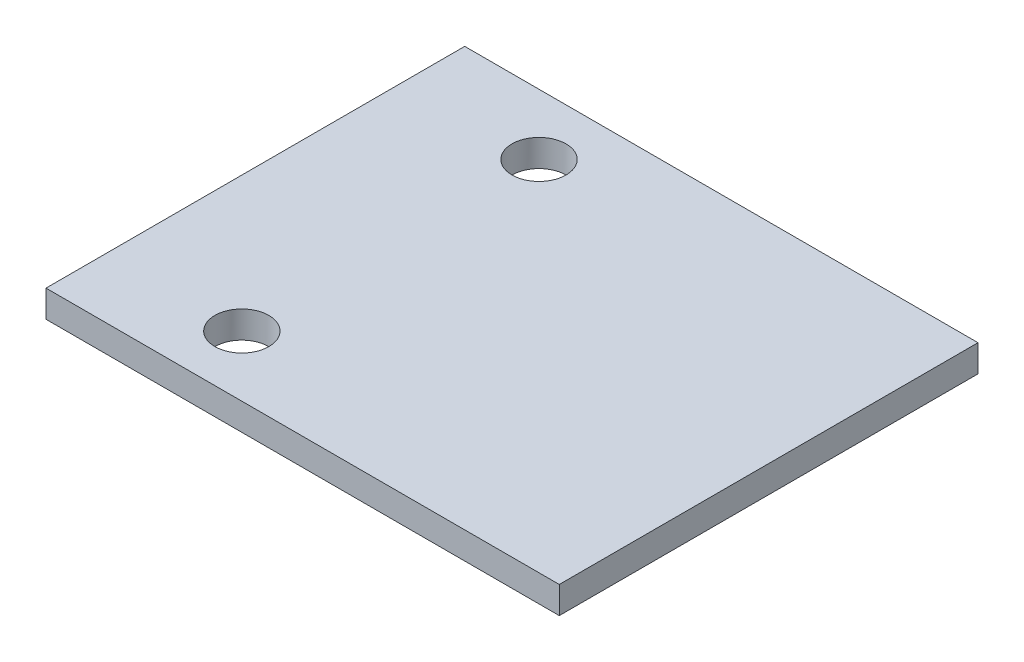
from build123d import *

# Parameters (mm, degrees)
SKETCH1_W                 = 19
SKETCH1_H                 = 15.5
BOSS_EXTRUDE1_DEPTH       = 1
F_1_0MM_DOWEL_HOLE1_D     = 2
F_1_0MM_DOWEL_HOLE1_DEPTH = 25
F_1_0MM_DOWEL_HOLE1_TIP   = 0.600860619


with BuildPart() as part:
    # Sketch1 → Boss-Extrude1 (new body)
    with BuildSketch(Plane(origin=(0, 0, 0), x_dir=(1, 0, 0), z_dir=(0, 1, 0))):
        with Locations((-2.301324503, -0.240066225)):
            Rectangle(SKETCH1_W, SKETCH1_H)
    extrude(amount=BOSS_EXTRUDE1_DEPTH)

    # Ø1.0mm Dowel Hole1
    with Locations(Plane(origin=(0, 1, 0), x_dir=(1, 0, 0), z_dir=(0, 1, 0))):
        with Locations((-6.801324503, 5.259933775), (-6.801324503, -5.740066225)):
            Hole(F_1_0MM_DOWEL_HOLE1_D / 2, depth=F_1_0MM_DOWEL_HOLE1_DEPTH)
            with Locations((0, 0, -(F_1_0MM_DOWEL_HOLE1_DEPTH + F_1_0MM_DOWEL_HOLE1_TIP / 2))):  # 118° drill point
                Cone(0, F_1_0MM_DOWEL_HOLE1_D / 2, F_1_0MM_DOWEL_HOLE1_TIP, mode=Mode.SUBTRACT)


solid = part.part
